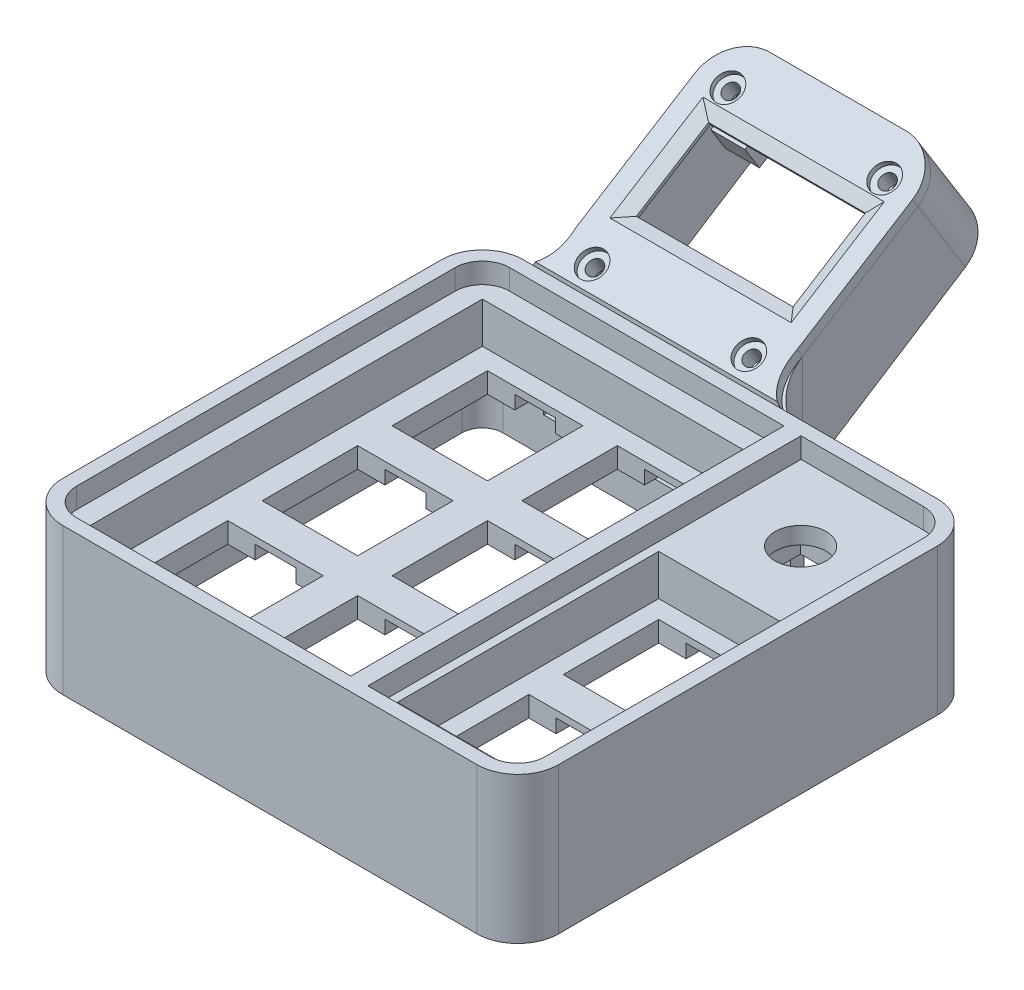
from build123d import *

# Parameters (mm, degrees)
SKIZZE1_W                        = 72.75
SKIZZE1_H                        = 67.555
SKIZZE1_W_2                      = 14
SKIZZE1_H_2                      = 14
AUFSATZ_LINEAR_AUSTRAGEN1_DEPTH  = 3
SKIZZE2_W                        = 72.75
SKIZZE2_H                        = 67.555
SKIZZE2_W_2                      = 68.75
SKIZZE2_H_2                      = 63.555
AUFSATZ_LINEAR_AUSTRAGEN2_DEPTH  = 9
SKIZZE3_W                        = 2.5
SKIZZE3_H                        = 63.555
AUFSATZ_LINEAR_AUSTRAGEN3_DEPTH  = 9
SKIZZE4_W                        = 44.25
SKIZZE4_H                        = 63.555
SKIZZE4_W_2                      = 40
SKIZZE4_H_2                      = 57.555
AUFSATZ_LINEAR_AUSTRAGEN4_DEPTH  = 6
SKIZZE5_W                        = 22
SKIZZE5_H                        = 63.555
SKIZZE5_W_2                      = 19.3
SKIZZE5_H_2                      = 38.35
AUFSATZ_LINEAR_AUSTRAGEN5_DEPTH  = 6
SKIZZE6_R                        = 3.75
SCHNITT_LINEAR_AUSTRAGEN1_DEPTH  = 82.991532503
SKIZZE7_W                        = 16
SKIZZE7_H                        = 16
SCHNITT_LINEAR_AUSTRAGEN2_DEPTH  = 6.5
SKIZZE8_W                        = 72.75
SKIZZE8_H                        = 67.555
SKIZZE8_W_2                      = 68.75
SKIZZE8_H_2                      = 63.555
AUFSATZ_LINEAR_AUSTRAGEN6_DEPTH  = 9.5
SKIZZE14_W                       = 6
SKIZZE14_H                       = 56.1
SKIZZE14_H_2                     = 37.05
SCHNITT_LINEAR_AUSTRAGEN8_DEPTH  = 2
VERRUNDUNG1_R                    = 6
AUFSATZ_LINEAR_AUSTRAGEN8_DEPTH  = 12
AUFSATZ_LINEAR_AUSTRAGEN10_DEPTH = 16
SCHNITT_LINEAR_AUSTRAGEN11_DEPTH = 14
VERRUNDUNG3_R                    = 6
SCHNITT_LINEAR_START             = -4
SKIZZE26_W                       = 28
SKIZZE26_H                       = 4.219186383
SCHNITT_LINEAR_AUSTRAGEN12_DEPTH = 4
VERRUNDUNG4_R                    = 3
SKIZZE28_W                       = 27
SKIZZE28_H                       = 2.594469543
SCHNITT_LINEAR_AUSTRAGEN13_DEPTH = 9.5
SKIZZE30_W                       = 5
SKIZZE30_H                       = 7
AUFSATZ_LINEAR_AUSTRAGEN11_DEPTH = 4
SCHNITT_LINEAR_START_2           = -8.1
SKIZZE29_R                       = 1.1
SCHNITT_LINEAR_AUSTRAGEN14_DEPTH = 4
AUFSATZ_LINEAR_AUSTRAGEN12_DEPTH = 1.5
SKIZZE34_R                       = 1.1
SKIZZE34_W                       = 23
SKIZZE34_H                       = 12.5
SCHNITT_LINEAR_AUSTRAGEN16_DEPTH = 108.381936349
SKIZZE36_R                       = 2
SCHNITT_LINEAR_AUSTRAGEN17_DEPTH = 0.8
VERRUNDUNG5_R                    = 1
SKIZZE38_W                       = 19.030857107
SKIZZE38_H                       = 9.5
SCHNITT_LINEAR_AUSTRAGEN18_DEPTH = 10
AUFSATZ_LINEAR_START             = 1.8
SKIZZE46_R                       = 2.325026698
SKIZZE46_R_2                     = 1.1
SKIZZE46_R_3                     = 2
AUFSATZ_LINEAR_AUSTRAGEN17_DEPTH = 1.8
CHAMFER1_SIZE                    = 1.8
CHAMFER1_SIZE2                   = 1.039230485
SCHNITT_LINEAR_AUSTRAGEN23_DEPTH = 112.419020083


with BuildPart() as part:
    # Skizze1 → Aufsatz-Linear austragen1 (new body)
    with BuildSketch(Plane(origin=(0, 0, 0), x_dir=(1, 0, 0), z_dir=(0, 1, 0))):
        with Locations((-32.078891722, 10.445526923)):
            Rectangle(SKIZZE1_W, SKIZZE1_H)
        with Locations((-52.978891722, 29.498026923)):
            Rectangle(SKIZZE1_W_2, SKIZZE1_H_2, mode=Mode.SUBTRACT)
        with Locations((-33.928891722, 29.498026923)):
            Rectangle(SKIZZE1_W_2, SKIZZE1_H_2, mode=Mode.SUBTRACT)
        with Locations((-52.978891722, 10.448026923)):
            Rectangle(SKIZZE1_W_2, SKIZZE1_H_2, mode=Mode.SUBTRACT)
        with Locations((-33.928891722, 10.448026923)):
            Rectangle(SKIZZE1_W_2, SKIZZE1_H_2, mode=Mode.SUBTRACT)
        with Locations((-8.803891722, 10.448026923)):
            Rectangle(SKIZZE1_W_2, SKIZZE1_H_2, mode=Mode.SUBTRACT)
        with Locations((-52.978891722, -8.601973077)):
            Rectangle(SKIZZE1_W_2, SKIZZE1_H_2, mode=Mode.SUBTRACT)
        with Locations((-33.928891722, -8.601973077)):
            Rectangle(SKIZZE1_W_2, SKIZZE1_H_2, mode=Mode.SUBTRACT)
        with Locations((-8.803891722, -8.601973077)):
            Rectangle(SKIZZE1_W_2, SKIZZE1_H_2, mode=Mode.SUBTRACT)
    extrude(amount=AUFSATZ_LINEAR_AUSTRAGEN1_DEPTH)

    # Skizze2 → Aufsatz-Linear austragen2 (add)
    with BuildSketch(Plane(origin=(0, 3, 0), x_dir=(1, 0, 0), z_dir=(0, 1, 0))):
        with Locations((-32.078891722, 10.445526923)):
            Rectangle(SKIZZE2_W, SKIZZE2_H)
        with Locations((-32.078891722, 10.445526923)):
            Rectangle(SKIZZE2_W_2, SKIZZE2_H_2, mode=Mode.SUBTRACT)
    extrude(amount=AUFSATZ_LINEAR_AUSTRAGEN2_DEPTH)

    # Skizze3 → Aufsatz-Linear austragen3 (add)
    with BuildSketch(Plane(origin=(0, 3, 0), x_dir=(1, 0, 0), z_dir=(0, 1, 0))):
        with Locations((-20.953891722, 10.445526923)):
            Rectangle(SKIZZE3_W, SKIZZE3_H)
    extrude(amount=AUFSATZ_LINEAR_AUSTRAGEN3_DEPTH)

    # Skizze4 → Aufsatz-Linear austragen4 (add)
    with BuildSketch(Plane(origin=(0, 3, 0), x_dir=(1, 0, 0), z_dir=(0, 1, 0))):
        with Locations((-44.328891722, 10.445526923)):
            Rectangle(SKIZZE4_W, SKIZZE4_H)
        with Locations((-43.453891722, 10.445526923)):
            Rectangle(SKIZZE4_W_2, SKIZZE4_H_2, mode=Mode.SUBTRACT)
    extrude(amount=AUFSATZ_LINEAR_AUSTRAGEN4_DEPTH)

    # Skizze5 → Aufsatz-Linear austragen5 (add)
    with BuildSketch(Plane(origin=(0, 3, 0), x_dir=(1, 0, 0), z_dir=(0, 1, 0))):
        with Locations((-8.703891722, 10.445526923)):
            Rectangle(SKIZZE5_W, SKIZZE5_H)
        with Locations((-8.803891722, 0.923026923)):
            Rectangle(SKIZZE5_W_2, SKIZZE5_H_2, mode=Mode.SUBTRACT)
    extrude(amount=AUFSATZ_LINEAR_AUSTRAGEN5_DEPTH)

    # Skizze6 → Schnitt-Linear austragen1 (cut, through all)
    with BuildSketch(Plane(origin=(0, 9, 0), x_dir=(1, 0, 0), z_dir=(0, 1, 0))):
        with Locations(Location((-8.703891722, 31.160526923, 0), (0, 0, 270))):
            Circle(SKIZZE6_R)
    extrude(amount=-SCHNITT_LINEAR_AUSTRAGEN1_DEPTH, mode=Mode.SUBTRACT)

    # Skizze7 → Schnitt-Linear austragen2 (cut)
    with BuildSketch(Plane.XZ):
        with Locations((-8.703891722, -31.160526923)):
            Rectangle(SKIZZE7_W, SKIZZE7_H)
    extrude(amount=-SCHNITT_LINEAR_AUSTRAGEN2_DEPTH, mode=Mode.SUBTRACT)

    # Skizze8 → Aufsatz-Linear austragen6 (add)
    with BuildSketch(Plane.XZ):
        with Locations((-32.078891722, -10.445526923)):
            Rectangle(SKIZZE8_W, SKIZZE8_H)
        with Locations((-32.078891722, -10.445526923)):
            Rectangle(SKIZZE8_W_2, SKIZZE8_H_2, mode=Mode.SUBTRACT)
    extrude(amount=AUFSATZ_LINEAR_AUSTRAGEN6_DEPTH)

    # Skizze14 → Schnitt-Linear austragen8 (cut)
    with BuildSketch(Plane.XZ):
        with Locations((-52.978891722, -10.448026923)):
            Rectangle(SKIZZE14_W, SKIZZE14_H)
        with Locations((-33.928891722, -10.448026923)):
            Rectangle(SKIZZE14_W, SKIZZE14_H)
        with Locations((-8.803891722, -0.923026923)):
            Rectangle(SKIZZE14_W, SKIZZE14_H_2)
    extrude(amount=-SCHNITT_LINEAR_AUSTRAGEN8_DEPTH, mode=Mode.SUBTRACT)

    # Verrundung1
    verrundung1_edges = [part.edges().sort_by_distance(p)[0] for p in [
        (-68.453891722, 1.25, -44.223026923),
        (4.296108278, 1.25, -44.223026923),
        (4.296108278, 1.25, 23.331973077),
        (-68.453891722, 1.25, 23.331973077),
    ]]
    fillet(verrundung1_edges, radius=VERRUNDUNG1_R)

    # Skizze17 → Aufsatz-Linear austragen8 (add)
    with BuildSketch(Plane(origin=(0, 12, 0), x_dir=(1, 0, 0), z_dir=(0, 1, 0))):
        with BuildLine():
            Line((-62.453891722, -23.331973077), (-1.703891722, -23.331973077))
            ThreePointArc((-1.703891722, -23.331973077), (2.538748965, -21.574613764), (4.296108278, -17.331973077))
            Line((4.296108278, -17.331973077), (4.296108278, 38.223026923))
            ThreePointArc((4.296108278, 38.223026923), (2.538748965, 42.46566761), (-1.703891722, 44.223026923))
            Line((-1.703891722, 44.223026923), (-62.453891722, 44.223026923))
            ThreePointArc((-62.453891722, 44.223026923), (-66.696532409, 42.46566761), (-68.453891722, 38.223026923))
            Line((-68.453891722, 38.223026923), (-68.453891722, -17.331973077))
            ThreePointArc((-68.453891722, -17.331973077), (-66.696532409, -21.574613764), (-62.453891722, -23.331973077))
        make_face()
        with BuildLine():
            Line((-62.453891722, -21.331973077), (-1.703891722, -21.331973077))
            ThreePointArc((-1.703891722, -21.331973077), (1.124535403, -20.160400202), (2.296108278, -17.331973077))
            Line((2.296108278, -17.331973077), (2.296108278, 38.223026923))
            ThreePointArc((2.296108278, 38.223026923), (1.124535403, 41.051454048), (-1.703891722, 42.223026923))
            Line((-1.703891722, 42.223026923), (-62.453891722, 42.223026923))
            ThreePointArc((-62.453891722, 42.223026923), (-65.282318847, 41.051454048), (-66.453891722, 38.223026923))
            Line((-66.453891722, 38.223026923), (-66.453891722, -17.331973077))
            ThreePointArc((-66.453891722, -17.331973077), (-65.282318847, -20.160400202), (-62.453891722, -21.331973077))
        make_face(mode=Mode.SUBTRACT)
    extrude(amount=-AUFSATZ_LINEAR_AUSTRAGEN8_DEPTH)

    # Skizze21 → Aufsatz-Linear austragen10 (add, symmetric)
    with BuildSketch(Plane.ZY.offset(43.453891722)):
        Polygon((-72.208614096, 27.98733572), (-44.223026923, 10.5), (-44.223026923, -5.5), (-79.155054051, 16.870708007), align=None)
    extrude(amount=AUFSATZ_LINEAR_AUSTRAGEN10_DEPTH, both=True)

    # Skizze25 → Schnitt-Linear austragen11 (cut, symmetric)
    with BuildSketch(Plane.ZY.offset(43.453891722)):
        Polygon((-70.108300026, 27.574381018), (-46.223026923, 22.796282585), (-46.223026923, -7.306847979), (-84.183921648, 5.04867772), align=None)
    extrude(amount=SCHNITT_LINEAR_AUSTRAGEN11_DEPTH, both=True, mode=Mode.SUBTRACT)

    # Verrundung3
    # the kernel refuses this fillet: 6 mm, written as the material it adds along each edge
    with BuildSketch(Plane(origin=(-27.453891722, 25.5, -44.223026923), x_dir=(1, 0, 0), z_dir=(0, -1, 0))) as verrundung3_piece_1_section:
        with BuildLine():
            CenterArc((VERRUNDUNG3_R, -VERRUNDUNG3_R), VERRUNDUNG3_R, 90, 90)
            Line((0, -VERRUNDUNG3_R), (0, 0))
            Line((0, 0), (VERRUNDUNG3_R, 0))
        make_face()
    verrundung3_piece_1 = extrude(amount=46, mode=Mode.PRIVATE)
    verrundung3_piece_1 = split(verrundung3_piece_1, bisect_by=Plane(origin=(-27.336553411, 12.969281958, -48.174704102), z_dir=(0, -0.8480480961564275, -0.5299192642332026)), keep=Keep.TOP, mode=Mode.PRIVATE)
    verrundung3_piece_1 = split(verrundung3_piece_1, bisect_by=Plane(origin=(-27.336553411, 1.663417444, -55.408756601), z_dir=(0, 0.8421158242325814, 0.5392967073671787)), keep=Keep.TOP, mode=Mode.PRIVATE)
    add(verrundung3_piece_1)
    with BuildSketch(Plane(origin=(-59.453891722, 24.547375097, -44.223026923), x_dir=(-0.9991049126334702, 0, 0.04230098759681043), z_dir=(0, -1, 0))) as verrundung3_piece_2_section:
        with BuildLine():
            CenterArc((5.75694234, 5.867726513), VERRUNDUNG3_R, 182.424391449, 75.522487814)
            Line((-0.237687136, 5.613920587), (-0.837150083, 5.588539995))
            Line((-0.837150083, 5.588539995), (-0.599462948, -0.025380593))
            Line((-0.599462948, -0.025380593), (0.025380593, -0.599462948))
            ThreePointArc((0.025380593, -0.599462948), (3.02269533, -0.472559985), (4.378740418, -0.586772651))
            Line((4.378740418, -0.586772651), (4.504031502, 0))
        make_face()
    verrundung3_piece_2 = extrude(amount=44.094750193, mode=Mode.PRIVATE)
    verrundung3_piece_2 = split(verrundung3_piece_2, bisect_by=Plane(origin=(-59.249447361, 13.059850602, -48.319644231), z_dir=(0, -0.8480480961564275, -0.5299192642332026)), keep=Keep.TOP, mode=Mode.PRIVATE)
    verrundung3_piece_2 = split(verrundung3_piece_2, bisect_by=Plane(origin=(-59.249447361, 1.755315768, -55.552256518), z_dir=(0, 0.8421158242325814, 0.5392967073671787)), keep=Keep.TOP, mode=Mode.PRIVATE)
    add(verrundung3_piece_2)
    # the kernel refuses this fillet: 6 mm, written as the material it takes off along each edge
    with BuildSketch(Plane(origin=(-27.453891722, 4.149986564, -87.103843014), x_dir=(0, -0.5299192642332053, 0.8480480961564256), z_dir=(0, 0.8480480961564257, 0.5299192642332055)), Plane(origin=(-59.453891722, 4.149986564, -87.103843014), x_dir=(1, 0, 0), z_dir=(0, 0.8480480961564257, 0.5299192642332055))) as verrundung3_2_piece_1:
        with BuildLine():
            CenterArc((VERRUNDUNG3_R, -VERRUNDUNG3_R), VERRUNDUNG3_R, 90, 90)
            Line((0, -VERRUNDUNG3_R), (0, 0))
            Line((0, 0), (VERRUNDUNG3_R, 0))
        make_face()
    extrude(amount=43.108487318, mode=Mode.SUBTRACT)

    # Skizze26 → Schnitt-Linear austragen12 (cut)
    with BuildSketch(Plane(origin=(0, 0, -46.223026923), x_dir=(-1, 0, 0), z_dir=(0, 0, -1)).offset(SCHNITT_LINEAR_START)):
        with Locations((43.453891722, -2.109593192)):
            Rectangle(SKIZZE26_W, SKIZZE26_H)
    extrude(amount=SCHNITT_LINEAR_AUSTRAGEN12_DEPTH, mode=Mode.SUBTRACT)

    # Verrundung4
    verrundung4_edges = [part.edges().sort_by_distance(p)[0] for p in [
        (2.296108278, -4.75, 21.331973077),
        (-66.453891722, -4.75, 21.331973077),
        (-66.453891722, -4.75, -42.223026923),
        (2.296108278, -4.75, -42.223026923),
    ]]
    fillet(verrundung4_edges, radius=VERRUNDUNG4_R)

    # Skizze28 → Schnitt-Linear austragen13 (cut)
    with BuildSketch(Plane.XZ.offset(9.5)):
        with Locations((-43.953891722, -45.520261695)):
            Rectangle(SKIZZE28_W, SKIZZE28_H)
    extrude(amount=-SCHNITT_LINEAR_AUSTRAGEN13_DEPTH, mode=Mode.SUBTRACT)

    # Skizze30 → Aufsatz-Linear austragen11 (add)
    with BuildSketch(Plane(origin=(0, -15.799245327, -9.872464188), x_dir=(1, 0, 0), z_dir=(0, 0.8480480961564277, 0.5299192642332022))):
        with Locations((-54.953891722, 70.567406063)):
            Rectangle(SKIZZE30_W, SKIZZE30_H)
        with Locations((-31.953891722, 70.567406063)):
            Rectangle(SKIZZE30_W, SKIZZE30_H)
        with Locations((-31.953891722, 48.92576287)):
            Rectangle(SKIZZE30_W, SKIZZE30_H)
        with Locations((-54.953891722, 48.92576287)):
            Rectangle(SKIZZE30_W, SKIZZE30_H)
    extrude(amount=-AUFSATZ_LINEAR_AUSTRAGEN11_DEPTH)

    # Skizze29 → Schnitt-Linear austragen14 (cut)
    with BuildSketch(Plane(origin=(0, -12.322248133, -7.699795205), x_dir=(1, 0, 0), z_dir=(0, 0.8480480961564277, 0.5299192642332022)).offset(SCHNITT_LINEAR_START_2)):
        with Locations(Location((-54.953891722, 70.567406063, 0), (0, 0, 270))):
            Circle(SKIZZE29_R)
        with Locations(Location((-31.953891722, 70.567406063, 0), (0, 0, 90))):
            Circle(SKIZZE29_R)
        with Locations(Location((-54.953891722, 47.067406063, 0), (0, 0, 90))):
            Circle(SKIZZE29_R)
        with Locations(Location((-31.953891722, 47.067406063, 0), (0, 0, 270))):
            Circle(SKIZZE29_R)
    extrude(amount=SCHNITT_LINEAR_AUSTRAGEN14_DEPTH, mode=Mode.SUBTRACT)

    # Verrundung5
    verrundung5_edges = [part.edges().sort_by_distance(p)[0] for p in [
        (-29.453891722, 25.188998594, -71.598852396),
        (-57.453891722, 25.188998594, -71.598852396),
        (-57.453891722, 17.925177899, -76.137791326),
        (-29.453891722, 17.925177899, -76.137791326),
    ]]
    fillet(verrundung5_edges, radius=VERRUNDUNG5_R)

    # Skizze38 → Schnitt-Linear austragen18 (cut)
    with BuildSketch(Plane(origin=(0, 0, -44.223026923), x_dir=(-1, 0, 0), z_dir=(0, 0, -1))):
        with Locations((11.728502721, -4.75)):
            Rectangle(SKIZZE38_W, SKIZZE38_H)
    extrude(amount=-SCHNITT_LINEAR_AUSTRAGEN18_DEPTH, mode=Mode.SUBTRACT)


with BuildPart() as body_2:
    # Skizze32 → Aufsatz-Linear austragen12 (new body)
    with BuildSketch(Plane(origin=(0, -12.322248133, -7.699795205), x_dir=(1, 0, 0), z_dir=(0, 0.8480480961564277, 0.5299192642332022))):
        with BuildLine():
            Line((-27.453891722, 50.142476483), (-27.453891722, 70.067406063))
            ThreePointArc((-27.453891722, 70.067406063), (-29.211251035, 74.31004675), (-33.453891722, 76.067406063))
            Line((-33.453891722, 76.067406063), (-53.453891722, 76.067406063))
            ThreePointArc((-53.453891722, 76.067406063), (-57.696532409, 74.31004675), (-59.453891722, 70.067406063))
            Line((-59.453891722, 70.067406063), (-59.453891722, 49.693150598))
            add(Edge.make_bspline(
                [(-62.314868577, 43.067406063), (-58.870082876, 45.259313486), (-59.453891722, 49.693150598)],
                knots=[0, 0, 0, 1, 1, 1], degree=2))
            Line((-62.314868577, 43.067406063), (-22.966753582, 43.067406063))
            add(Edge.make_bspline(
                [(-27.453891722, 50.142476483), (-27.74409362, 44.31760341), (-22.966753582, 43.067406063)],
                knots=[0, 0, 0, 1, 1, 1], degree=2))
        make_face()
    extrude(amount=AUFSATZ_LINEAR_AUSTRAGEN12_DEPTH)

    # Skizze34 → Schnitt-Linear austragen16 (cut, through all)
    with BuildSketch(Plane(origin=(0, -11.050175989, -6.904916309), x_dir=(1, 0, 0), z_dir=(0, 0.8480480961564277, 0.5299192642332022))):
        with Locations(Location((-54.953891722, 70.567406063, 0), (0, 0, 270))):
            Circle(SKIZZE34_R)
        with Locations(Location((-31.953891722, 70.567406063, 0), (0, 0, 270))):
            Circle(SKIZZE34_R)
        with Locations(Location((-54.953891722, 47.067406063, 0), (0, 0, 270))):
            Circle(SKIZZE34_R)
        with Locations(Location((-31.953891722, 47.067406063, 0), (0, 0, 270))):
            Circle(SKIZZE34_R)
        with Locations((-43.453891722, 60.317406063)):
            Rectangle(SKIZZE34_W, SKIZZE34_H)
    extrude(amount=-SCHNITT_LINEAR_AUSTRAGEN16_DEPTH, mode=Mode.SUBTRACT)

    # Skizze36 → Schnitt-Linear austragen17 (cut)
    with BuildSketch(Plane(origin=(0, -11.050175989, -6.904916309), x_dir=(1, 0, 0), z_dir=(0, 0.8480480961564277, 0.5299192642332022))):
        with Locations(Location((-54.953891722, 70.567406063, 0), (0, 0, 270))):
            Circle(SKIZZE36_R)
        with Locations(Location((-31.953891722, 70.567406063, 0), (0, 0, 270))):
            Circle(SKIZZE36_R)
        with Locations(Location((-31.953891722, 47.067406063, 0), (0, 0, 270))):
            Circle(SKIZZE36_R)
        with Locations(Location((-54.953891722, 47.067406063, 0), (0, 0, 270))):
            Circle(SKIZZE36_R)
    extrude(amount=-SCHNITT_LINEAR_AUSTRAGEN17_DEPTH, mode=Mode.SUBTRACT)

    # Skizze46 → Aufsatz-Linear austragen17 (add)
    # profile 1 of 4: a face of its own
    with BuildSketch(Plane(origin=(0, -12.322248133, -7.699795205), x_dir=(1, 0, 0), z_dir=(0, -0.8480480961564277, -0.5299192642332023)).offset(AUFSATZ_LINEAR_START)):
        with Locations(Location((-54.953891722, -47.067406063, 0), (0, 0, 270))):
            Circle(SKIZZE46_R)
        with Locations(Location((-54.953891722, -47.067406063, 0), (0, 0, 90))):
            Circle(SKIZZE46_R_2, mode=Mode.SUBTRACT)
    # profile 2 of 4: a face of its own
    with BuildSketch(Plane(origin=(0, -12.322248133, -7.699795205), x_dir=(1, 0, 0), z_dir=(0, -0.8480480961564277, -0.5299192642332023)).offset(AUFSATZ_LINEAR_START)):
        with Locations(Location((-31.953891722, -70.567406063, 0), (0, 0, 270))):
            Circle(SKIZZE46_R)
        with Locations(Location((-31.953891722, -70.567406063, 0), (0, 0, 90))):
            Circle(SKIZZE46_R_2, mode=Mode.SUBTRACT)
    # profile 3 of 4: a face of its own
    with BuildSketch(Plane(origin=(0, -12.322248133, -7.699795205), x_dir=(1, 0, 0), z_dir=(0, -0.8480480961564277, -0.5299192642332023)).offset(AUFSATZ_LINEAR_START)):
        with Locations(Location((-54.953891722, -70.567406063, 0), (0, 0, 90))):
            Circle(SKIZZE46_R_3)
        with Locations(Location((-54.953891722, -70.567406063, 0), (0, 0, 90))):
            Circle(SKIZZE46_R_2, mode=Mode.SUBTRACT)
    # profile 4 of 4: a face of its own
    with BuildSketch(Plane(origin=(0, -12.322248133, -7.699795205), x_dir=(1, 0, 0), z_dir=(0, -0.8480480961564277, -0.5299192642332023)).offset(AUFSATZ_LINEAR_START)):
        with Locations(Location((-31.953891722, -47.067406063, 0), (0, 0, 270))):
            Circle(SKIZZE46_R)
        with Locations(Location((-31.953891722, -47.067406063, 0), (0, 0, 90))):
            Circle(SKIZZE46_R_2, mode=Mode.SUBTRACT)
    extrude(amount=-AUFSATZ_LINEAR_AUSTRAGEN17_DEPTH)

    # Chamfer1
    chamfer1_edges = [body_2.edges().sort_by_distance(p)[0] for p in [
        (-54.953891722, 20.913179452, -58.056977685),
        (-43.453891722, 17.601184051, -52.756677084),
        (-31.953891722, 20.913179452, -58.056977685),
        (-43.453891722, 24.225174854, -63.357278286),
    ]]
    chamfer1_side = [body_2.faces().sort_by_distance(p)[0] for p in [
        (-27.967435701, 20.800590267, -57.876797325),
    ]]
    chamfer(chamfer1_edges, length=CHAMFER1_SIZE, length2=CHAMFER1_SIZE2, reference=chamfer1_side[0])

    # Skizze47 → Schnitt-Linear austragen23 (cut, through all)
    with BuildSketch(Plane.ZY.offset(68.453891722)):
        Polygon((-44.432501942, 15.148805303), (-44.432501942, 8.28211513), (-42.042285846, 8.972929031), (-42.15281607, 13.656647278), align=None)
    extrude(amount=-SCHNITT_LINEAR_AUSTRAGEN23_DEPTH, mode=Mode.SUBTRACT)


solid = Compound([part.part, body_2.part])
